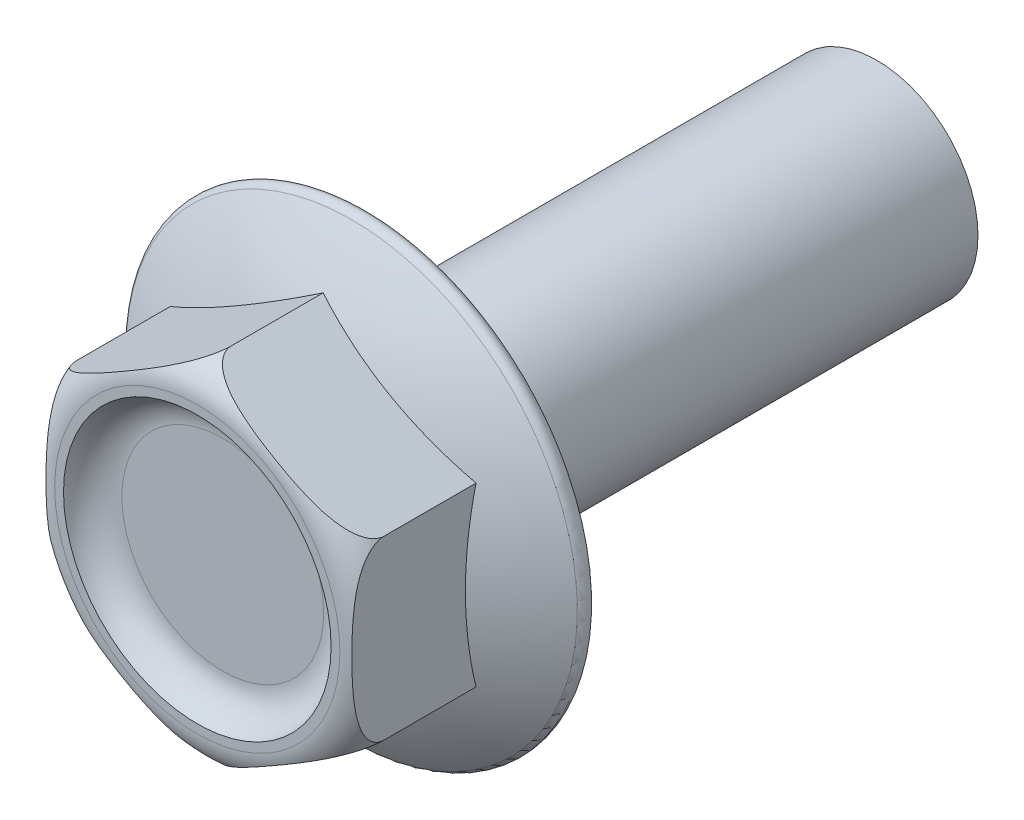
from build123d import *

# Parameters (mm, degrees)
HEAD_DEPTH     = 10
SHANK_SKETCH_R = 6
SHANK_DEPTH    = 30
SKETCH6_R      = 7.875
HEAD_CUT_DEPTH = 1.5
FILLET1_R      = 2
FILLET2_R      = 0.5
THREAD_END_W   = 30
THREAD_END_H   = 0.05


with BuildPart() as part:
    # Head Sketch → Head (new body)
    with BuildSketch(Plane.XY):
        Polygon((0, 10.392304845), (9, 5.196152423), (9, -5.196152423), (0, -10.392304845), (-9, -5.196152423), (-9, 5.196152423), align=None)
    extrude(amount=HEAD_DEPTH)

    # Shank Sketch → Shank (add)
    with BuildSketch(Plane.XY):
        Circle(SHANK_SKETCH_R)
    extrude(amount=-SHANK_DEPTH)

    # Sketch3 → Flange (revolve)
    with BuildSketch(Plane(origin=(0, 0, 0), x_dir=(-1, 0, 0), z_dir=(0, 1, 0)), mode=Mode.PRIVATE) as flange_sk:
        with BuildLine():
            Line((-13, 0), (0, 0))
            Line((0, 0), (0, 5))
            ThreePointArc((0, 5), (-6.947778179, 3.955279081), (-13.281081081, 0.913513514))
            ThreePointArc((-13.281081081, 0.913513514), (-13.477889504, 0.352957076), (-13, 0))
        make_face()
    revolve(flange_sk.sketch.rotate(Axis((0, 0, 0), (0, 0, 1)), 30), axis=Axis((0, 0, 0), (0, 0, 1)))

    # Sketch5 → Head Trim (revolve, cut)
    with BuildSketch(Plane(origin=(0, 0, 0), x_dir=(0, 0, -1), z_dir=(1, 0, 0)), mode=Mode.PRIVATE) as head_trim_sk:
        with BuildLine():
            Line((-10, -8.392304845), (-10, -10.392304845))
            Line((-10, -10.392304845), (-8, -10.392304845))
            ThreePointArc((-8, -10.392304845), (-9.414213562, -9.806518408), (-10, -8.392304845))
        make_face()
    revolve(head_trim_sk.sketch.rotate(Axis((0, 0, 15.085599173), (0, 0, -1)), 90), axis=Axis((0, 0, 15.085599173), (0, 0, -1)), mode=Mode.SUBTRACT)

    # Sketch6 → Head Cut (cut)
    with BuildSketch(Plane.XY.offset(10)):
        Circle(SKETCH6_R)
    extrude(amount=-HEAD_CUT_DEPTH, mode=Mode.SUBTRACT)

    # Fillet1
    # the kernel refuses this fillet: 2 mm, written as the material it adds along each edge
    with BuildSketch(Plane(origin=(0, 0, 8.5), x_dir=(1, 0, 0), z_dir=(0, -1, 0))) as fillet1_piece_1:
        with BuildLine():
            CenterArc((5.938508327, 2), FILLET1_R, 270, 75.522487814)
            Line((5.938508327, 0), (5.938508327, -0.04))
            Line((5.938508327, -0.04), (7.875, -0.04))
            Line((7.875, -0.04), (7.915, 0))
            ThreePointArc((7.915, 0), (7.915, 0.75), (7.913729833, 1.49))
            Line((7.913729833, 1.49), (7.875, 1.5))
        make_face()
    revolve(axis=Axis((0, 0, 8.5), (0, 0, 1)))

    # Fillet2
    fillet2_edges = [part.edges().sort_by_distance(p)[0] for p in [
        (-6, 0, 0),
    ]]
    fillet(fillet2_edges, radius=FILLET2_R)

    # Thread End → Thread Cut (revolve, cut)
    with BuildSketch(Plane(origin=(0, 0, 0), x_dir=(0, 0, -1), z_dir=(1, 0, 0)), mode=Mode.PRIVATE) as thread_cut_sk:
        with Locations((15, 5.975)):
            Rectangle(THREAD_END_W, THREAD_END_H)
    revolve(thread_cut_sk.sketch.rotate(Axis((0, 0, -21.551935625), (0, 0, -1)), 90), axis=Axis((0, 0, -21.551935625), (0, 0, -1)), mode=Mode.SUBTRACT)


solid = part.part
